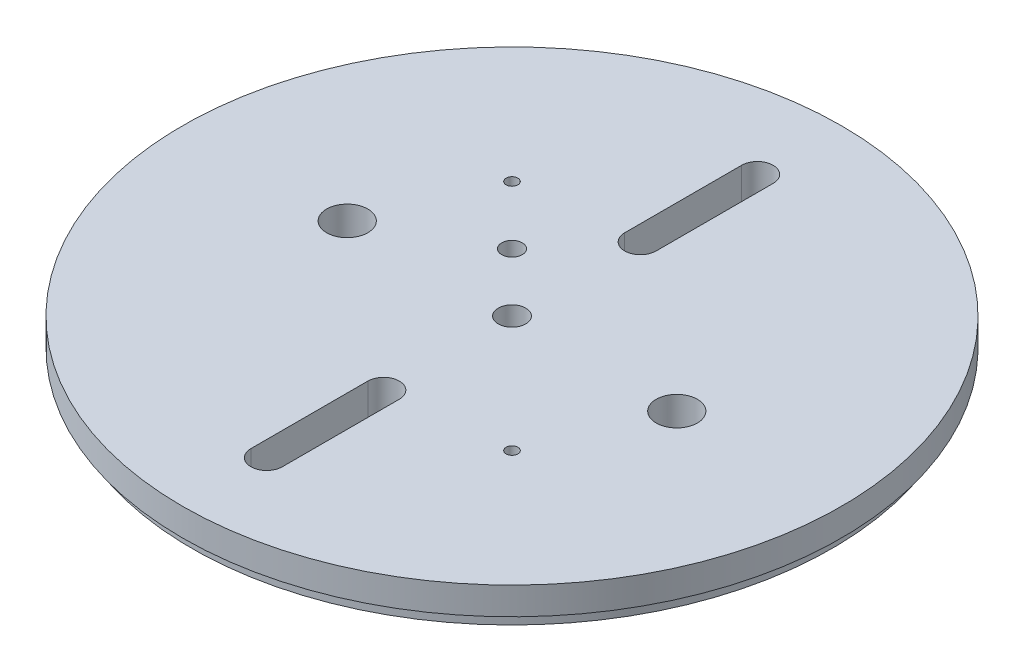
from build123d import *

# Parameters (mm, degrees)
SKETCH1_R           = 76.2
SKETCH1_R_2         = 3.175
SKETCH1_R_3         = 4.7625
SKETCH1_R_4         = 1.3589
SKETCH1_R_5         = 2.38125
BOSS_EXTRUDE1_DEPTH = 9.525
SKETCH2_R           = 76.2
SKETCH2_R_2         = 74.041
CUT_EXTRUDE1_DEPTH  = 3.175


with BuildPart() as part:
    # Sketch1 → Boss-Extrude1 (new body)
    with BuildSketch(Plane(origin=(0, 0, 0), x_dir=(1, 0, 0), z_dir=(0, 1, 0))):
        Circle(SKETCH1_R)
        Circle(SKETCH1_R_2, mode=Mode.SUBTRACT)
        with Locations((38.1, 0)):
            Circle(SKETCH1_R_3, mode=Mode.SUBTRACT)
        with Locations((-38.1, 0)):
            Circle(SKETCH1_R_3, mode=Mode.SUBTRACT)
        with Locations((-26.940768363, 26.940768363)):
            Circle(SKETCH1_R_4, mode=Mode.SUBTRACT)
        with Locations((26.940768363, -26.940768363)):
            Circle(SKETCH1_R_4, mode=Mode.SUBTRACT)
        with Locations((-13.470384182, 13.470384182)):
            Circle(SKETCH1_R_5, mode=Mode.SUBTRACT)
        with BuildLine():
            Line((3.640657811, 56.738707511), (3.640657811, 29.693624258))
            ThreePointArc((3.640657811, 29.693624258), (0, 26.052966447), (-3.640657811, 29.693624258))
            Line((-3.640657811, 29.693624258), (-3.640657811, 56.738707511))
            ThreePointArc((-3.640657811, 56.738707511), (0, 60.379365322), (3.640657811, 56.738707511))
        make_face(mode=Mode.SUBTRACT)
        with BuildLine():
            Line((3.640657811, -56.738707511), (3.640657811, -29.693624258))
            ThreePointArc((3.640657811, -29.693624258), (0, -26.052966447), (-3.640657811, -29.693624258))
            Line((-3.640657811, -29.693624258), (-3.640657811, -56.738707511))
            ThreePointArc((-3.640657811, -56.738707511), (0, -60.379365322), (3.640657811, -56.738707511))
        make_face(mode=Mode.SUBTRACT)
    extrude(amount=BOSS_EXTRUDE1_DEPTH)

    # Sketch2 → Cut-Extrude1 (cut)
    with BuildSketch(Plane.XZ):
        Circle(SKETCH2_R)
        Circle(SKETCH2_R_2, mode=Mode.SUBTRACT)
    extrude(amount=-CUT_EXTRUDE1_DEPTH, mode=Mode.SUBTRACT)


solid = part.part
